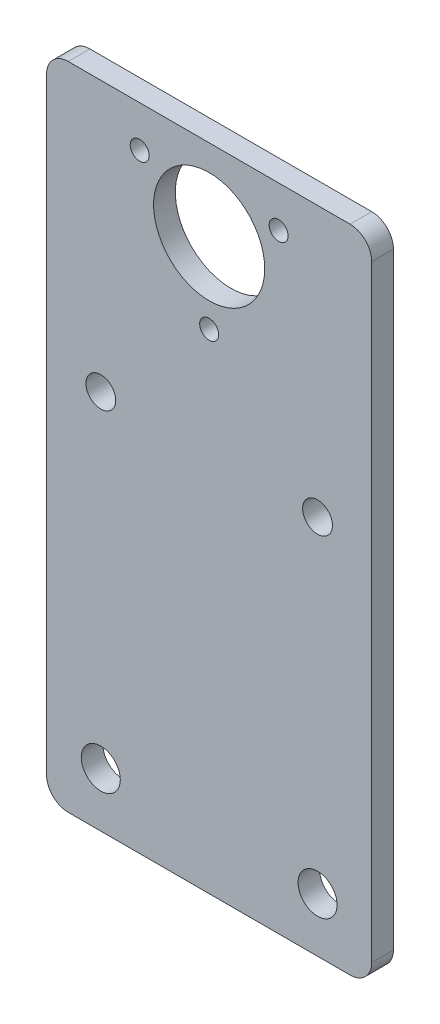
from build123d import *

# Parameters (mm, degrees)
SZKIC1_W                    = 60
SZKIC1_H                    = 120
SZKIC1_R                    = 2.75
SZKIC1_R_2                  = 3.6
SZKIC1_R_3                  = 10.25
SZKIC1_R_4                  = 1.75
DODANIE_WYCI_GNI_CIE1_DEPTH = 4
ZAOKR_GLENIE1_R             = 4


with BuildPart() as part:
    # Szkic1 → Dodanie-wyciągnięcie1 (new body)
    with BuildSketch(Plane.XY):
        with Locations((19.115931961, 35.506335127)):
            Rectangle(SZKIC1_W, SZKIC1_H)
        with Locations((-0.884068039, 45.706335127)):
            Circle(SZKIC1_R, mode=Mode.SUBTRACT)
        with Locations((-0.884068039, -14.493664873)):
            Circle(SZKIC1_R_2, mode=Mode.SUBTRACT)
        with Locations((39.115931961, -14.493664873)):
            Circle(SZKIC1_R_2, mode=Mode.SUBTRACT)
        with Locations((39.115931961, 45.706335127)):
            Circle(SZKIC1_R, mode=Mode.SUBTRACT)
        with Locations((19.115931961, 80.506335127)):
            Circle(SZKIC1_R_3, mode=Mode.SUBTRACT)
        with Locations((6.298755985, 87.906335127)):
            Circle(SZKIC1_R_4, mode=Mode.SUBTRACT)
        with Locations((31.933107937, 87.906335127)):
            Circle(SZKIC1_R_4, mode=Mode.SUBTRACT)
        with Locations((19.115931961, 65.706335127)):
            Circle(SZKIC1_R_4, mode=Mode.SUBTRACT)
    extrude(amount=DODANIE_WYCI_GNI_CIE1_DEPTH)

    # Zaokrąglenie1
    zaokr_glenie1_edges = [part.edges().sort_by_distance(p)[0] for p in [
        (49.115931961, 95.506335127, 2),
        (49.115931961, -24.493664873, 2),
        (-10.884068039, -24.493664873, 2),
        (-10.884068039, 95.506335127, 2),
    ]]
    fillet(zaokr_glenie1_edges, radius=ZAOKR_GLENIE1_R)


solid = part.part
